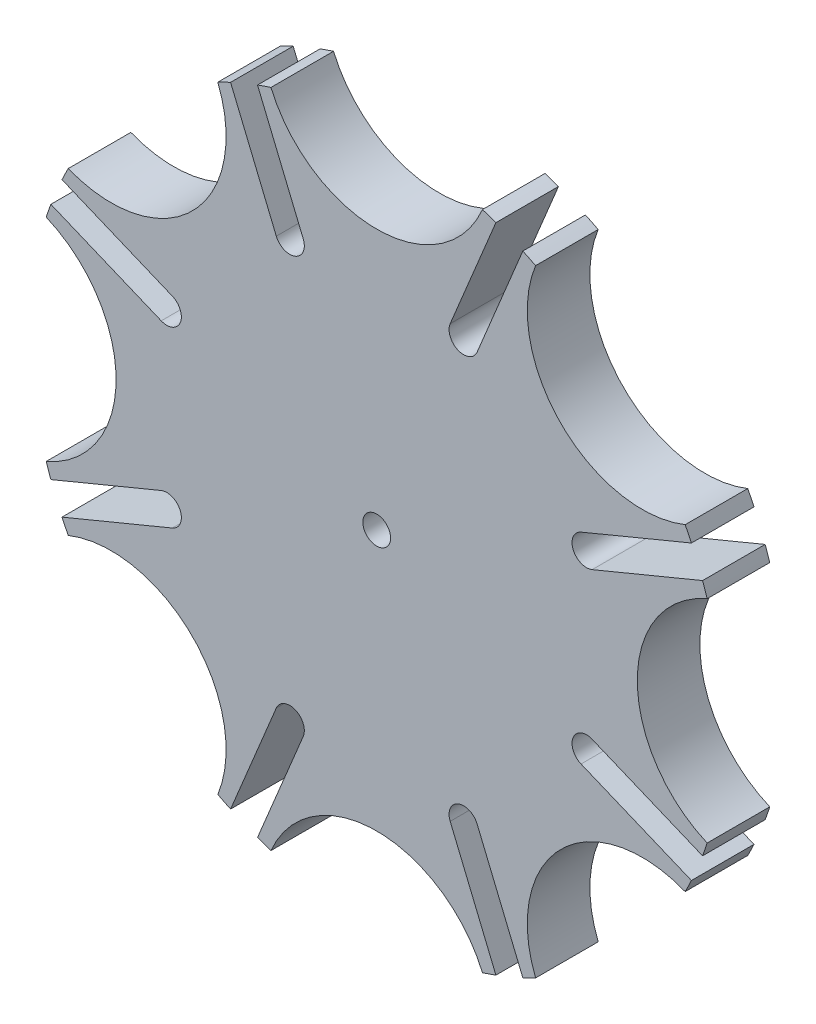
from build123d import *

# Parameters (mm, degrees)
CROQUIS1_R              = 0.665193263
SALIENTE_EXTRUIR1_DEPTH = 3


with BuildPart() as part:
    # Croquis1 → Saliente-Extruir1 (new body)
    with BuildSketch(Plane.XY):
        with BuildLine():
            ThreePointArc((-9.79326678, 4.81250392), (-9.41526678, 4.43450392), (-9.41526678, 3.899931194))
            ThreePointArc((-9.41526678, 3.899931194), (-9.79326678, 3.521931194), (-10.327839507, 3.521931194))
            Line((-10.327839507, 3.521931194), (-15.617663918, 5.713131566))
            ThreePointArc((-15.617663918, 5.713131566), (-15.731353029, 5.392200889), (-15.838448045, 5.06900997))
            ThreePointArc((-15.838448045, 5.06900997), (-12.489358574, 0), (-15.838448045, -5.06900997))
            ThreePointArc((-15.838448045, -5.06900997), (-15.731365526, -5.392164431), (-15.617690399, -5.713059176))
            Line((-15.617690399, -5.713059176), (-10.327839507, -3.521931194))
            ThreePointArc((-10.327839507, -3.521931194), (-9.41526678, -3.899931194), (-9.79326678, -4.81250392))
            Line((-9.79326678, -4.81250392), (-15.083117672, -7.003631903))
            ThreePointArc((-15.083117672, -7.003631903), (-14.936591275, -7.310919206), (-14.78380534, -7.615142693))
            ThreePointArc((-14.78380534, -7.615142693), (-8.83131014, -8.83131014), (-7.615142693, -14.78380534))
            ThreePointArc((-7.615142693, -14.78380534), (-7.310919206, -14.936591275), (-7.003631903, -15.083117672))
            Line((-7.003631903, -15.083117672), (-4.81250392, -9.79326678))
            ThreePointArc((-4.81250392, -9.79326678), (-3.899931194, -9.41526678), (-3.521931194, -10.327839507))
            Line((-3.521931194, -10.327839507), (-5.713059176, -15.617690399))
            ThreePointArc((-5.713059176, -15.617690399), (-5.392164431, -15.731365526), (-5.06900997, -15.838448045))
            ThreePointArc((-5.06900997, -15.838448045), (0, -12.489358574), (5.06900997, -15.838448045))
            ThreePointArc((5.06900997, -15.838448045), (5.392164431, -15.731365526), (5.713059176, -15.617690399))
            Line((5.713059176, -15.617690399), (3.521931194, -10.327839507))
            ThreePointArc((3.521931194, -10.327839507), (3.899931194, -9.41526678), (4.81250392, -9.79326678))
            Line((4.81250392, -9.79326678), (7.003631903, -15.083117672))
            ThreePointArc((7.003631903, -15.083117672), (7.310919206, -14.936591275), (7.615142693, -14.78380534))
            ThreePointArc((7.615142693, -14.78380534), (8.83131014, -8.83131014), (14.78380534, -7.615142693))
            ThreePointArc((14.78380534, -7.615142693), (14.936591275, -7.310919206), (15.083117672, -7.003631903))
            Line((15.083117672, -7.003631903), (9.79326678, -4.81250392))
            ThreePointArc((9.79326678, -4.81250392), (9.41526678, -3.899931194), (10.327839507, -3.521931194))
            Line((10.327839507, -3.521931194), (15.617690399, -5.713059176))
            ThreePointArc((15.617690399, -5.713059176), (15.731365526, -5.392164431), (15.838448045, -5.06900997))
            ThreePointArc((15.838448045, -5.06900997), (12.489358574, 0), (15.838448045, 5.06900997))
            ThreePointArc((15.838448045, 5.06900997), (15.731365526, 5.392164431), (15.617690399, 5.713059176))
            Line((15.617690399, 5.713059176), (10.327839507, 3.521931194))
            ThreePointArc((10.327839507, 3.521931194), (9.41526678, 3.899931194), (9.79326678, 4.81250392))
            Line((9.79326678, 4.81250392), (15.083117672, 7.003631903))
            ThreePointArc((15.083117672, 7.003631903), (14.936591275, 7.310919206), (14.78380534, 7.615142693))
            ThreePointArc((14.78380534, 7.615142693), (8.83131014, 8.83131014), (7.615142693, 14.78380534))
            ThreePointArc((7.615142693, 14.78380534), (7.310919206, 14.936591275), (7.003631903, 15.083117672))
            Line((7.003631903, 15.083117672), (4.81250392, 9.79326678))
            ThreePointArc((4.81250392, 9.79326678), (3.899931194, 9.41526678), (3.521931194, 10.327839507))
            Line((3.521931194, 10.327839507), (5.713059176, 15.617690399))
            ThreePointArc((5.713059176, 15.617690399), (5.392164431, 15.731365526), (5.06900997, 15.838448045))
            ThreePointArc((5.06900997, 15.838448045), (0, 12.489358574), (-5.06900997, 15.838448045))
            ThreePointArc((-5.06900997, 15.838448045), (-5.392164431, 15.731365526), (-5.713059176, 15.617690399))
            Line((-5.713059176, 15.617690399), (-3.521931194, 10.327839507))
            ThreePointArc((-3.521931194, 10.327839507), (-3.899931194, 9.41526678), (-4.81250392, 9.79326678))
            Line((-4.81250392, 9.79326678), (-7.003631903, 15.083117672))
            ThreePointArc((-7.003631903, 15.083117672), (-7.310919206, 14.936591275), (-7.615142693, 14.78380534))
            ThreePointArc((-7.615142693, 14.78380534), (-8.83131014, 8.83131014), (-14.78380534, 7.615142693))
            ThreePointArc((-14.78380534, 7.615142693), (-14.936608218, 7.31088459), (-15.083150135, 7.003561991))
            Line((-15.083150135, 7.003561991), (-9.79326678, 4.81250392))
        make_face()
        Circle(CROQUIS1_R, mode=Mode.SUBTRACT)
    extrude(amount=-SALIENTE_EXTRUIR1_DEPTH)


solid = part.part
